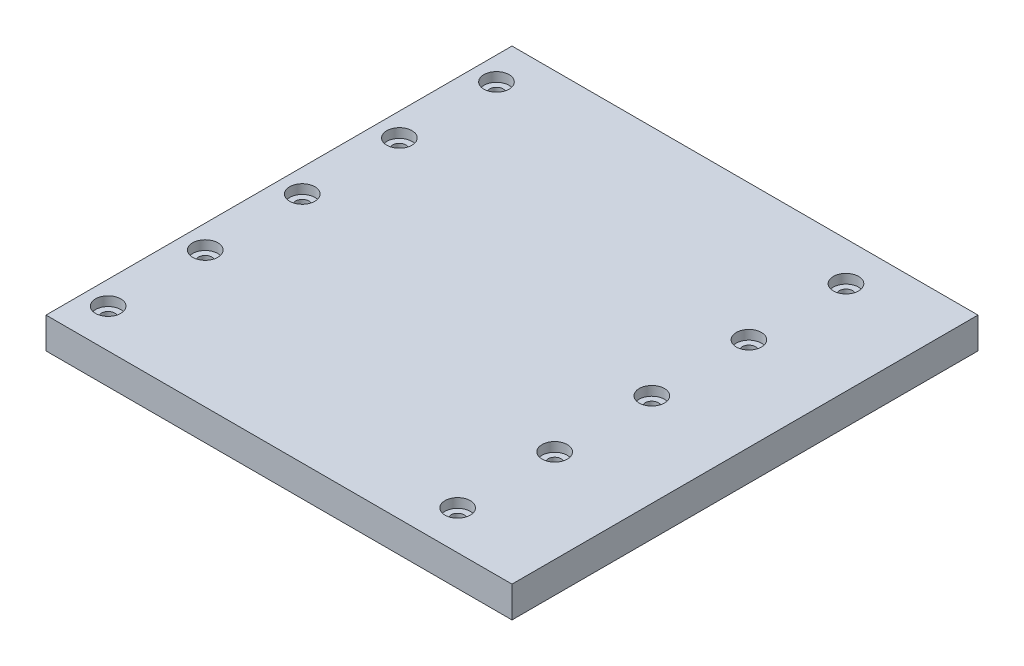
from build123d import *

# Parameters (mm, degrees)
SKETCH1_W                                            = 120
SKETCH1_H                                            = 120
BOSS_EXTRUDE1_DEPTH                                  = 8
CBORE_FOR_M3_HEX_SOCKET_THIN_HEAD_CAP_SC_D           = 3.4
CBORE_FOR_M3_HEX_SOCKET_THIN_HEAD_CAP_SC_CBORE_D     = 6.5
CBORE_FOR_M3_HEX_SOCKET_THIN_HEAD_CAP_SC_CBORE_DEPTH = 2.4


with BuildPart() as part:
    # Sketch1 → Boss-Extrude1 (new body)
    with BuildSketch(Plane(origin=(0, 0, 0), x_dir=(1, 0, 0), z_dir=(0, 1, 0))):
        with Locations((60, 60)):
            Rectangle(SKETCH1_W, SKETCH1_H)
    extrude(amount=BOSS_EXTRUDE1_DEPTH)

    # CBORE for M3 Hex Socket Thin Head Cap Screw1 (through all)
    with Locations(Plane(origin=(0, 8, 0), x_dir=(1, 0, 0), z_dir=(0, 1, 0))):
        with Locations((96, 110), (6, 110), (6, 85), (6, 60), (6, 35), (6, 10), (96, 60), (96, 35), (96, 10), (96, 85)):
            CounterBoreHole(CBORE_FOR_M3_HEX_SOCKET_THIN_HEAD_CAP_SC_D / 2, CBORE_FOR_M3_HEX_SOCKET_THIN_HEAD_CAP_SC_CBORE_D / 2, CBORE_FOR_M3_HEX_SOCKET_THIN_HEAD_CAP_SC_CBORE_DEPTH)


solid = part.part
